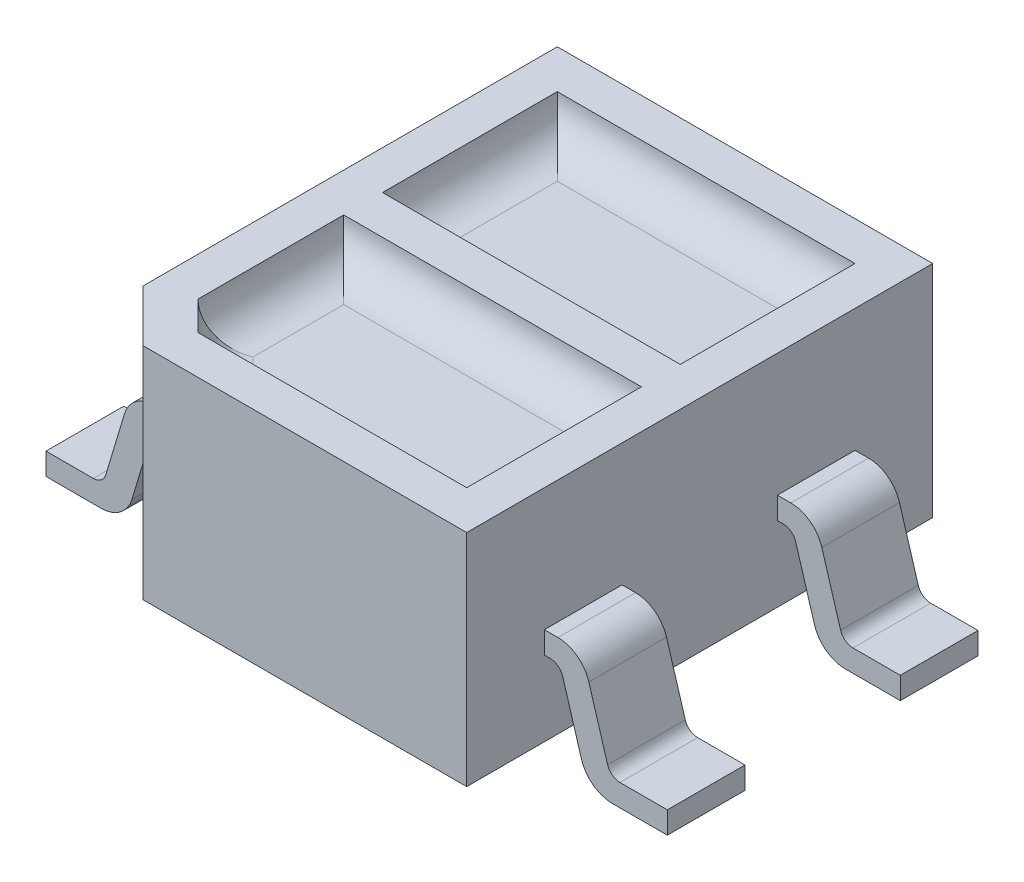
from build123d import *

# Parameters (mm, degrees)
EXTRUDE_1_DEPTH     = 1.7
SKETCH_2_W          = 2.3
SKETCH_2_H          = 1.35
CUT_EXTRUDE_1_DEPTH = 0.3
FILLET_1_R          = 0.3
FILLET_2_R          = 0.3
EXTRUDE_2_DEPTH     = 3.6
SKETCH_4_W          = 0.95
SKETCH_4_H          = 0.6
SKETCH_4_H_2        = 1.2
CUT_EXTRUDE_2_DEPTH = 3.6


with BuildPart() as part:
    # Эскиз1 → Бобышка-Вытянуть1 (new body)
    with BuildSketch(Plane(origin=(0, 0, 0), x_dir=(1, 0, 0), z_dir=(0, 1, 0))):
        Polygon((1.45, -1.8), (-1.05, -1.8), (-1.45, -1.4), (-1.45, 1.8), (1.45, 1.8), align=None)
    extrude(amount=EXTRUDE_1_DEPTH)

    # Эскиз2 → Вырез-Вытянуть1 (cut)
    with BuildSketch(Plane(origin=(0, 1.7, 0), x_dir=(1, 0, 0), z_dir=(0, 1, 0))):
        with Locations((0, 0.825)):
            Rectangle(SKETCH_2_W, SKETCH_2_H)
        Polygon((-1.15, -1.275735931), (-0.925735931, -1.5), (1.15, -1.5), (1.15, -0.15), (-1.15, -0.15), align=None)
    extrude(amount=-CUT_EXTRUDE_1_DEPTH, mode=Mode.SUBTRACT)

    # Скругление1
    fillet_1_edges = [part.edges().sort_by_distance(p)[0] for p in [
        (0, 1.4, -0.15),
        (-1.15, 1.4, -0.825),
        (0, 1.4, -1.5),
        (1.15, 1.4, -0.825),
    ]]
    fillet(fillet_1_edges, radius=FILLET_1_R - 0.0001)  # a hair under: the kernel refuses the full size

    # Скругление2
    fillet_2_edges = [part.edges().sort_by_distance(p)[0] for p in [
        (0.112132034, 1.4, 1.5),
        (-1.037867966, 1.4, 1.387867966),
        (-1.15, 1.4, 0.712867966),
        (0, 1.4, 0.15),
        (1.15, 1.4, 0.825),
    ]]
    fillet(fillet_2_edges, radius=FILLET_2_R - 0.0001)  # a hair under: the kernel refuses the full size

    # Эскиз3 → Бобышка-Вытянуть2 (add)
    with BuildSketch(Plane.XY.offset(1.8)):
        with BuildLine():
            ThreePointArc((-2.034305524, 0.02), (-1.974662878, 0.039733227), (-1.93855907, 0.091144904))
            Line((-1.93855907, 0.091144904), (-1.793602325, 0.572137739))
            ThreePointArc((-1.793602325, 0.572137739), (-1.703342805, 0.700666932), (-1.55423619, 0.75))
            Line((-1.55423619, 0.75), (-1.45, 0.75))
            Line((-1.45, 0.75), (-1.45, 0.58))
            Line((-1.45, 0.58), (-1.495694476, 0.58))
            ThreePointArc((-1.495694476, 0.58), (-1.555337122, 0.560266773), (-1.59144093, 0.508855096))
            Line((-1.59144093, 0.508855096), (-1.736397675, 0.027862261))
            ThreePointArc((-1.736397675, 0.027862261), (-1.826657195, -0.100666932), (-1.97576381, -0.15))
            Line((-1.97576381, -0.15), (-2.4, -0.15))
            Line((-2.4, -0.15), (-2.4, 0.02))
            Line((-2.4, 0.02), (-2.034305524, 0.02))
        make_face()
        with BuildLine():
            ThreePointArc((1.495694476, 0.58), (1.555337122, 0.560266773), (1.59144093, 0.508855096))
            Line((1.59144093, 0.508855096), (1.736397675, 0.027862261))
            ThreePointArc((1.736397675, 0.027862261), (1.826657195, -0.100666932), (1.97576381, -0.15))
            Line((1.97576381, -0.15), (2.4, -0.15))
            Line((2.4, -0.15), (2.4, 0.02))
            Line((2.4, 0.02), (2.034305524, 0.02))
            ThreePointArc((2.034305524, 0.02), (1.974662878, 0.039733227), (1.93855907, 0.091144904))
            Line((1.93855907, 0.091144904), (1.793602325, 0.572137739))
            ThreePointArc((1.793602325, 0.572137739), (1.703342805, 0.700666932), (1.55423619, 0.75))
            Line((1.55423619, 0.75), (1.45, 0.75))
            Line((1.45, 0.75), (1.45, 0.58))
            Line((1.45, 0.58), (1.495694476, 0.58))
        make_face()
    extrude(amount=-EXTRUDE_2_DEPTH)

    # Эскиз4 → Вырез-Вытянуть2 (cut)
    with BuildSketch(Plane(origin=(0, 0.75, 0), x_dir=(1, 0, 0), z_dir=(0, 1, 0))):
        with Locations((1.925, 1.5)):
            Rectangle(SKETCH_4_W, SKETCH_4_H)
        with Locations((-1.925, 1.5)):
            Rectangle(SKETCH_4_W, SKETCH_4_H)
        with Locations((1.925, 0)):
            Rectangle(SKETCH_4_W, SKETCH_4_H_2)
        with Locations((-1.925, 0)):
            Rectangle(SKETCH_4_W, SKETCH_4_H_2)
        with Locations((-1.925, -1.5)):
            Rectangle(SKETCH_4_W, SKETCH_4_H)
        with Locations((1.925, -1.5)):
            Rectangle(SKETCH_4_W, SKETCH_4_H)
    extrude(amount=-CUT_EXTRUDE_2_DEPTH, mode=Mode.SUBTRACT)


solid = part.part
